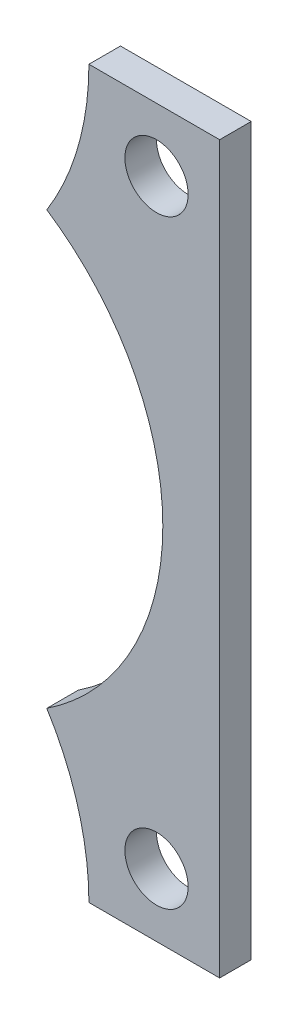
from build123d import *

# Parameters (mm, degrees)
SKETCH1_R           = 6.3627
BOSS_EXTRUDE1_DEPTH = 3.175


with BuildPart() as part:
    # Sketch1 → Boss-Extrude1 (new, symmetric)
    with BuildSketch(Plane.XY):
        with BuildLine():
            ThreePointArc((-15.719319348, -43.426177466), (-9.406121761, -57.631125381), (-7.246114065, -73.025))
            Line((-7.246114065, -73.025), (19.05, -73.025))
            Line((19.05, -73.025), (19.05, 73.025))
            Line((19.05, 73.025), (-7.246114065, 73.025))
            ThreePointArc((-7.246114065, 73.025), (-9.406121761, 57.631125381), (-15.719319348, 43.426177466))
            ThreePointArc((-15.719319348, 43.426177466), (1.415517775, 24.650338319), (7.62, 0))
            ThreePointArc((7.62, 0), (1.415517775, -24.650338319), (-15.719319348, -43.426177466))
        make_face()
        with Locations((6.35, -60.325)):
            Circle(SKETCH1_R, mode=Mode.SUBTRACT)
        with Locations((6.35, 60.325)):
            Circle(SKETCH1_R, mode=Mode.SUBTRACT)
    extrude(amount=BOSS_EXTRUDE1_DEPTH, both=True)


solid = part.part
